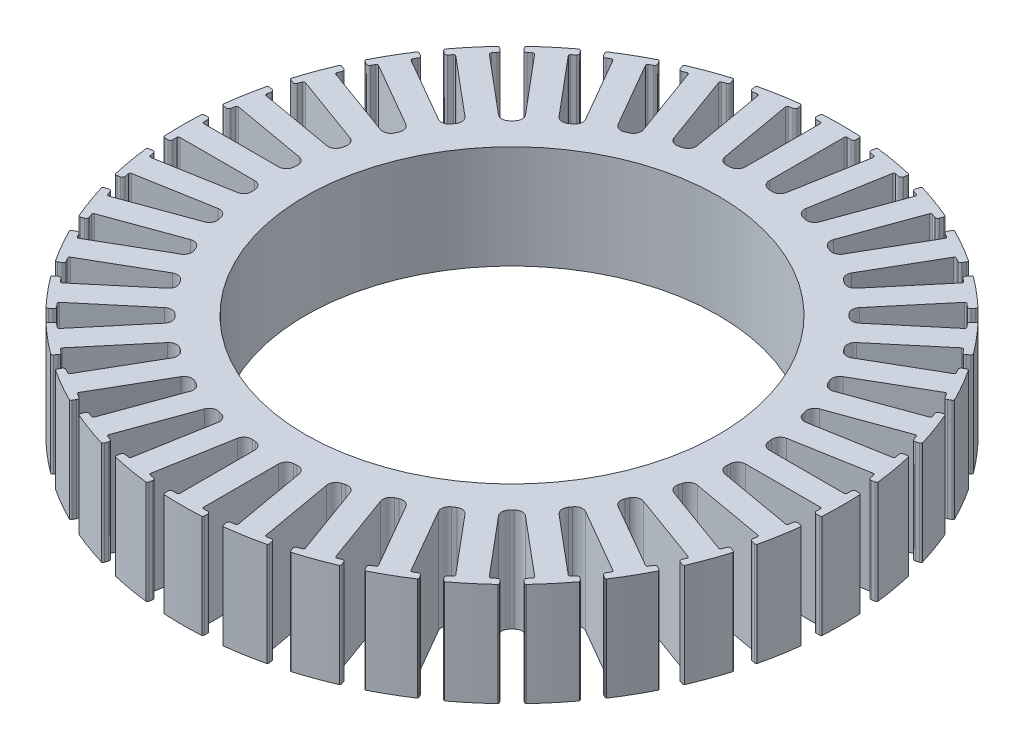
from build123d import *

# Parameters (mm, degrees)
SKETCH1_R           = 26
BOSS_EXTRUDE1_DEPTH = 13


with BuildPart() as part:
    # Sketch1 → Boss-Extrude1 (new body)
    with BuildSketch(Plane(origin=(0, 0, 0), x_dir=(1, 0, 0), z_dir=(0, 1, 0))):
        with BuildLine():
            ThreePointArc((40.3, -1.5), (40.441421356, -1.558578644), (40.5, -1.7))
            Line((40.5, -1.7), (40.5, -2.2))
            ThreePointArc((40.5, -2.2), (40.587867966, -2.412132034), (40.8, -2.5))
            Line((40.8, -2.5), (41.2, -2.5))
            ThreePointArc((41.2, -2.5), (41.327655665, -2.471484864), (41.431043872, -2.391360207))
            ThreePointArc((41.431043872, -2.391360207), (41.454359135, -1.94579256), (41.472882707, -1.5))
            ThreePointArc((41.472882707, -1.5), (41.493220123, -0.750122548), (41.5, 0))
            ThreePointArc((41.5, 0), (41.493220123, 0.750122548), (41.472882707, 1.5))
            ThreePointArc((41.472882707, 1.5), (41.454359135, 1.94579256), (41.431043872, 2.391360208))
            ThreePointArc((41.431043872, 2.391360208), (41.327655665, 2.471484864), (41.2, 2.5))
            Line((41.2, 2.5), (40.8, 2.5))
            ThreePointArc((40.8, 2.5), (40.587867966, 2.412132034), (40.5, 2.2))
            Line((40.5, 2.2), (40.5, 1.7))
            ThreePointArc((40.5, 1.7), (40.441421356, 1.558578644), (40.3, 1.5))
            Line((40.3, 1.5), (30.899029111, 1.5))
            ThreePointArc((30.899029111, 1.5), (30.221033964, 1.764933622), (29.902286236, 2.419354839))
            ThreePointArc((29.902286236, 2.419354839), (29.885840943, 2.614672282), (29.868119877, 2.809878111))
            ThreePointArc((29.868119877, 2.809878111), (30.068386059, 3.509707161), (30.690075696, 3.888348467))
            Line((30.690075696, 3.888348467), (39.948224713, 5.52080993))
            ThreePointArc((39.948224713, 5.52080993), (40.097669636, 5.487678789), (40.179915899, 5.358578015))
            Line((40.179915899, 5.358578015), (40.266739988, 4.866174139))
            ThreePointArc((40.266739988, 4.866174139), (40.390109383, 4.672522979), (40.614276767, 4.622826266))
            Line((40.614276767, 4.622826266), (41.008199868, 4.692285537))
            ThreePointArc((41.008199868, 4.692285537), (41.128964556, 4.742534638), (41.216868563, 4.839395195))
            ThreePointArc((41.216868563, 4.839395195), (41.060254143, 6.025407014), (40.86951955, 7.206411852))
            ThreePointArc((40.86951955, 7.206411852), (40.644825838, 8.381415909), (40.386357879, 9.54945534))
            ThreePointArc((40.386357879, 9.54945534), (40.27062687, 9.610409549), (40.13995898, 9.616324302))
            Line((40.13995898, 9.616324302), (39.746035879, 9.546865031))
            ThreePointArc((39.746035879, 9.546865031), (39.552384719, 9.423495636), (39.502688006, 9.199328252))
            Line((39.502688006, 9.199328252), (39.589512095, 8.706924376))
            ThreePointArc((39.589512095, 8.706924376), (39.556380953, 8.557479453), (39.42728018, 8.47523319))
            Line((39.42728018, 8.47523319), (30.169131163, 6.842771726))
            ThreePointArc((30.169131163, 6.842771726), (29.455431045, 6.985947789), (29.02788676, 7.575076915))
            ThreePointArc((29.02788676, 7.575076915), (28.977774789, 7.764571353), (28.92642581, 7.953734335))
            ThreePointArc((28.92642581, 7.953734335), (29.002125459, 8.677707267), (29.54861986, 9.158551434))
            Line((29.54861986, 9.158551434), (38.382642833, 12.373872845))
            ThreePointArc((38.382642833, 12.373872845), (38.535570514, 12.367195878), (38.638985385, 12.254338349))
            Line((38.638985385, 12.254338349), (38.809995457, 11.784492039))
            ThreePointArc((38.809995457, 11.784492039), (38.965117765, 11.615205746), (39.194509286, 11.605190296))
            Line((39.194509286, 11.605190296), (39.570386335, 11.741998353))
            ThreePointArc((39.570386335, 11.741998353), (39.68059067, 11.812454625), (39.750339559, 11.923108023))
            ThreePointArc((39.750339559, 11.923108023), (39.390155666, 13.06390587), (38.997239413, 14.193847897))
            ThreePointArc((38.997239413, 14.193847897), (38.571921997, 15.311983327), (38.114552837, 16.417395104))
            ThreePointArc((38.114552837, 16.417395104), (37.989995456, 16.457326803), (37.860285618, 16.440461457))
            Line((37.860285618, 16.440461457), (37.48440857, 16.3036534))
            ThreePointArc((37.48440857, 16.3036534), (37.315122277, 16.148531092), (37.305106827, 15.91913957))
            Line((37.305106827, 15.91913957), (37.476116898, 15.44929326))
            ThreePointArc((37.476116898, 15.44929326), (37.469439931, 15.296365579), (37.356582403, 15.192950707))
            Line((37.356582403, 15.192950707), (28.52255943, 11.977629296))
            ThreePointArc((28.52255943, 11.977629296), (27.794839758, 11.994697468), (27.271489632, 12.500634113))
            ThreePointArc((27.271489632, 12.500634113), (27.189233611, 12.678547852), (27.105816931, 12.855920367))
            ThreePointArc((27.105816931, 12.855920367), (27.054649952, 13.58203963), (27.509344162, 14.15047645))
            Line((27.509344162, 14.15047645), (35.650823773, 18.850961894))
            ThreePointArc((35.650823773, 18.850961894), (35.802587582, 18.870941979), (35.924028853, 18.777756814))
            Line((35.924028853, 18.777756814), (36.174028853, 18.344744112))
            ThreePointArc((36.174028853, 18.344744112), (36.356190761, 18.204966364), (36.583836474, 18.234936491))
            Line((36.583836474, 18.234936491), (36.930246636, 18.434936491))
            ThreePointArc((36.930246636, 18.434936491), (37.026542117, 18.523459156), (37.076016603, 18.644543247))
            ThreePointArc((37.076016603, 18.644543247), (36.523213281, 19.705453348), (35.940060611, 20.749988995))
            ThreePointArc((35.940060611, 20.749988995), (35.327036501, 21.777293038), (34.684656395, 22.786500626))
            ThreePointArc((34.684656395, 22.786500626), (34.555057253, 22.80419651), (34.430246636, 22.765063509))
            Line((34.430246636, 22.765063509), (34.083836474, 22.565063509))
            ThreePointArc((34.083836474, 22.565063509), (33.944058727, 22.382901602), (33.974028853, 22.155255888))
            Line((33.974028853, 22.155255888), (34.224028853, 21.722243186))
            ThreePointArc((34.224028853, 21.722243186), (34.244008938, 21.570479377), (34.150823773, 21.449038106))
            Line((34.150823773, 21.449038106), (26.009344162, 16.748552661))
            ThreePointArc((26.009344162, 16.748552661), (25.289716331, 16.638994334), (24.686462093, 17.046365869))
            ThreePointArc((24.686462093, 17.046365869), (24.574561329, 17.207293091), (24.461611522, 17.367485764))
            ThreePointArc((24.461611522, 17.367485764), (24.285132597, 18.073688591), (24.634210963, 18.712446399))
            Line((24.634210963, 18.712446399), (31.835772472, 24.755274006))
            ThreePointArc((31.835772472, 24.755274006), (31.981761143, 24.801304057), (32.117538883, 24.730622639))
            Line((32.117538883, 24.730622639), (32.438932688, 24.347600417))
            ThreePointArc((32.438932688, 24.347600417), (32.642599298, 24.241578291), (32.861582303, 24.310623367))
            Line((32.861582303, 24.310623367), (33.168000081, 24.567738411))
            ThreePointArc((33.168000081, 24.567738411), (33.247460817, 24.671637753), (33.275157643, 24.799473459))
            ThreePointArc((33.275157643, 24.799473459), (32.546527543, 25.748272658), (31.790852564, 26.67567606))
            ThreePointArc((31.790852564, 26.67567606), (31.00875219, 27.58092253), (30.200884219, 28.463249856))
            ThreePointArc((30.200884219, 28.463249856), (30.070181122, 28.458172245), (29.954062032, 28.397960627))
            Line((29.954062032, 28.397960627), (29.647644255, 28.140845583))
            ThreePointArc((29.647644255, 28.140845583), (29.541622128, 27.937178973), (29.610667205, 27.718195967))
            Line((29.610667205, 27.718195967), (29.93206101, 27.335173746))
            ThreePointArc((29.93206101, 27.335173746), (29.978091061, 27.189185075), (29.907409643, 27.053407335))
            Line((29.907409643, 27.053407335), (22.705848134, 21.010579729))
            ThreePointArc((22.705848134, 21.010579729), (22.01617767, 20.777723777), (21.351348894, 21.074152424))
            ThreePointArc((21.351348894, 21.074152424), (21.213203436, 21.213203436), (21.074152424, 21.351348894))
            ThreePointArc((21.074152424, 21.351348894), (20.777723777, 22.01617767), (21.010579729, 22.705848134))
            Line((21.010579729, 22.705848134), (27.053407335, 29.907409643))
            ThreePointArc((27.053407335, 29.907409643), (27.189185075, 29.978091061), (27.335173746, 29.93206101))
            Line((27.335173746, 29.93206101), (27.718195967, 29.610667205))
            ThreePointArc((27.718195967, 29.610667205), (27.937178973, 29.541622129), (28.140845583, 29.647644255))
            Line((28.140845583, 29.647644255), (28.397960627, 29.954062032))
            ThreePointArc((28.397960627, 29.954062032), (28.458172245, 30.070181122), (28.463249856, 30.200884219))
            ThreePointArc((28.463249856, 30.200884219), (27.580922542, 31.008752179), (26.675676084, 31.790852544))
            ThreePointArc((26.675676084, 31.790852544), (25.748272671, 32.546527533), (24.799473459, 33.275157643))
            ThreePointArc((24.799473459, 33.275157643), (24.671637753, 33.247460817), (24.567738411, 33.168000081))
            Line((24.567738411, 33.168000081), (24.310623367, 32.861582303))
            ThreePointArc((24.310623367, 32.861582303), (24.241578291, 32.642599298), (24.347600417, 32.438932688))
            Line((24.347600417, 32.438932688), (24.730622639, 32.117538883))
            ThreePointArc((24.730622639, 32.117538883), (24.801304057, 31.981761143), (24.755274006, 31.835772472))
            Line((24.755274006, 31.835772472), (18.712446399, 24.634210963))
            ThreePointArc((18.712446399, 24.634210963), (18.073688591, 24.285132597), (17.367485764, 24.461611522))
            ThreePointArc((17.367485764, 24.461611522), (17.207293091, 24.574561329), (17.046365869, 24.686462093))
            ThreePointArc((17.046365869, 24.686462093), (16.638994334, 25.289716331), (16.748552661, 26.009344162))
            Line((16.748552661, 26.009344162), (21.449038106, 34.150823773))
            ThreePointArc((21.449038106, 34.150823773), (21.570479377, 34.244008938), (21.722243186, 34.224028853))
            Line((21.722243186, 34.224028853), (22.155255888, 33.974028853))
            ThreePointArc((22.155255888, 33.974028853), (22.382901602, 33.944058727), (22.565063509, 34.083836474))
            Line((22.565063509, 34.083836474), (22.765063509, 34.430246636))
            ThreePointArc((22.765063509, 34.430246636), (22.804196509, 34.555057253), (22.786500625, 34.684656395))
            ThreePointArc((22.786500625, 34.684656395), (21.777293038, 35.327036501), (20.749988995, 35.940060611))
            ThreePointArc((20.749988995, 35.940060611), (19.705453348, 36.523213281), (18.644543247, 37.076016603))
            ThreePointArc((18.644543247, 37.076016603), (18.523459156, 37.026542117), (18.434936491, 36.930246636))
            Line((18.434936491, 36.930246636), (18.234936491, 36.583836474))
            ThreePointArc((18.234936491, 36.583836474), (18.204966364, 36.356190761), (18.344744112, 36.174028853))
            Line((18.344744112, 36.174028853), (18.777756814, 35.924028853))
            ThreePointArc((18.777756814, 35.924028853), (18.870941979, 35.802587582), (18.850961894, 35.650823773))
            Line((18.850961894, 35.650823773), (14.15047645, 27.509344162))
            ThreePointArc((14.15047645, 27.509344162), (13.58203963, 27.054649952), (12.855920367, 27.105816931))
            ThreePointArc((12.855920367, 27.105816931), (12.678547852, 27.189233611), (12.500634113, 27.271489632))
            ThreePointArc((12.500634113, 27.271489632), (11.994697468, 27.794839758), (11.977629296, 28.52255943))
            Line((11.977629296, 28.52255943), (15.192950707, 37.356582403))
            ThreePointArc((15.192950707, 37.356582403), (15.296365579, 37.469439931), (15.44929326, 37.476116898))
            Line((15.44929326, 37.476116898), (15.91913957, 37.305106827))
            ThreePointArc((15.91913957, 37.305106827), (16.148531092, 37.315122277), (16.3036534, 37.48440857))
            Line((16.3036534, 37.48440857), (16.440461457, 37.860285618))
            ThreePointArc((16.440461457, 37.860285618), (16.457326803, 37.989995456), (16.417395104, 38.114552837))
            ThreePointArc((16.417395104, 38.114552837), (15.311983327, 38.571921997), (14.193847897, 38.997239413))
            ThreePointArc((14.193847897, 38.997239413), (13.06390587, 39.390155666), (11.923108023, 39.750339559))
            ThreePointArc((11.923108023, 39.750339559), (11.812454625, 39.68059067), (11.741998353, 39.570386335))
            Line((11.741998353, 39.570386335), (11.605190296, 39.194509286))
            ThreePointArc((11.605190296, 39.194509286), (11.615205746, 38.965117765), (11.784492039, 38.809995457))
            Line((11.784492039, 38.809995457), (12.254338349, 38.638985385))
            ThreePointArc((12.254338349, 38.638985385), (12.367195878, 38.535570514), (12.373872845, 38.382642833))
            Line((12.373872845, 38.382642833), (9.158551434, 29.54861986))
            ThreePointArc((9.158551434, 29.54861986), (8.677707267, 29.002125459), (7.953734335, 28.92642581))
            ThreePointArc((7.953734335, 28.92642581), (7.764571353, 28.977774789), (7.575076915, 29.02788676))
            ThreePointArc((7.575076915, 29.02788676), (6.985947789, 29.455431045), (6.842771726, 30.169131163))
            Line((6.842771726, 30.169131163), (8.47523319, 39.42728018))
            ThreePointArc((8.47523319, 39.42728018), (8.557479453, 39.556380953), (8.706924376, 39.589512095))
            Line((8.706924376, 39.589512095), (9.199328252, 39.502688006))
            ThreePointArc((9.199328252, 39.502688006), (9.423495636, 39.552384719), (9.546865031, 39.746035879))
            Line((9.546865031, 39.746035879), (9.616324302, 40.13995898))
            ThreePointArc((9.616324302, 40.13995898), (9.610409549, 40.27062687), (9.54945534, 40.386357879))
            ThreePointArc((9.54945534, 40.386357879), (8.381415934, 40.644825832), (7.206411902, 40.869519541))
            ThreePointArc((7.206411902, 40.869519541), (6.025407039, 41.06025414), (4.839395195, 41.216868563))
            ThreePointArc((4.839395195, 41.216868563), (4.742534638, 41.128964556), (4.692285537, 41.008199868))
            Line((4.692285537, 41.008199868), (4.622826266, 40.614276767))
            ThreePointArc((4.622826266, 40.614276767), (4.672522979, 40.390109383), (4.866174139, 40.266739988))
            Line((4.866174139, 40.266739988), (5.358578015, 40.179915899))
            ThreePointArc((5.358578015, 40.179915899), (5.487678789, 40.097669636), (5.52080993, 39.948224713))
            Line((5.52080993, 39.948224713), (3.888348467, 30.690075696))
            ThreePointArc((3.888348467, 30.690075696), (3.509707161, 30.068386059), (2.809878111, 29.868119877))
            ThreePointArc((2.809878111, 29.868119877), (2.614672282, 29.885840943), (2.419354839, 29.902286236))
            ThreePointArc((2.419354839, 29.902286236), (1.764933622, 30.221033964), (1.5, 30.899029111))
            Line((1.5, 30.899029111), (1.5, 40.3))
            ThreePointArc((1.5, 40.3), (1.558578644, 40.441421356), (1.7, 40.5))
            Line((1.7, 40.5), (2.2, 40.5))
            ThreePointArc((2.2, 40.5), (2.412132034, 40.587867966), (2.5, 40.8))
            Line((2.5, 40.8), (2.5, 41.2))
            ThreePointArc((2.5, 41.2), (2.471484864, 41.327655665), (2.391360207, 41.431043872))
            ThreePointArc((2.391360207, 41.431043872), (1.196177099, 41.482757386), (4e-09, 41.5))
            ThreePointArc((4e-09, 41.5), (-1.196177095, 41.482757386), (-2.391360208, 41.431043872))
            ThreePointArc((-2.391360208, 41.431043872), (-2.471484864, 41.327655665), (-2.5, 41.2))
            Line((-2.5, 41.2), (-2.5, 40.8))
            ThreePointArc((-2.5, 40.8), (-2.412132034, 40.587867966), (-2.2, 40.5))
            Line((-2.2, 40.5), (-1.7, 40.5))
            ThreePointArc((-1.7, 40.5), (-1.558578644, 40.441421356), (-1.5, 40.3))
            Line((-1.5, 40.3), (-1.5, 30.899029111))
            ThreePointArc((-1.5, 30.899029111), (-1.764933622, 30.221033964), (-2.419354839, 29.902286236))
            ThreePointArc((-2.419354839, 29.902286236), (-2.614672282, 29.885840943), (-2.809878111, 29.868119877))
            ThreePointArc((-2.809878111, 29.868119877), (-3.509707161, 30.068386059), (-3.888348467, 30.690075696))
            Line((-3.888348467, 30.690075696), (-5.52080993, 39.948224713))
            ThreePointArc((-5.52080993, 39.948224713), (-5.487678789, 40.097669636), (-5.358578015, 40.179915899))
            Line((-5.358578015, 40.179915899), (-4.866174139, 40.266739988))
            ThreePointArc((-4.866174139, 40.266739988), (-4.672522979, 40.390109383), (-4.622826266, 40.614276767))
            Line((-4.622826266, 40.614276767), (-4.692285537, 41.008199868))
            ThreePointArc((-4.692285537, 41.008199868), (-4.742534638, 41.128964556), (-4.839395195, 41.216868563))
            ThreePointArc((-4.839395195, 41.216868563), (-6.025407014, 41.060254143), (-7.206411852, 40.86951955))
            ThreePointArc((-7.206411852, 40.86951955), (-8.381415909, 40.644825838), (-9.54945534, 40.386357879))
            ThreePointArc((-9.54945534, 40.386357879), (-9.610409549, 40.27062687), (-9.616324302, 40.13995898))
            Line((-9.616324302, 40.13995898), (-9.546865031, 39.746035879))
            ThreePointArc((-9.546865031, 39.746035879), (-9.423495636, 39.552384719), (-9.199328252, 39.502688006))
            Line((-9.199328252, 39.502688006), (-8.706924376, 39.589512095))
            ThreePointArc((-8.706924376, 39.589512095), (-8.557479453, 39.556380953), (-8.47523319, 39.42728018))
            Line((-8.47523319, 39.42728018), (-6.842771726, 30.169131163))
            ThreePointArc((-6.842771726, 30.169131163), (-6.985947789, 29.455431045), (-7.575076915, 29.02788676))
            Line((-7.575076915, 29.02788676), (-7.953734335, 28.929072846))
            ThreePointArc((-7.953734335, 28.929072846), (-8.677042913, 29.003735185), (-9.158551434, 29.54861986))
            Line((-9.158551434, 29.54861986), (-12.373872845, 38.382642833))
            ThreePointArc((-12.373872845, 38.382642833), (-12.367195878, 38.535570514), (-12.254338349, 38.638985385))
            Line((-12.254338349, 38.638985385), (-11.784492039, 38.809995457))
            ThreePointArc((-11.784492039, 38.809995457), (-11.615205746, 38.965117765), (-11.605190296, 39.194509286))
            Line((-11.605190296, 39.194509286), (-11.741998353, 39.570386335))
            ThreePointArc((-11.741998353, 39.570386335), (-11.812454625, 39.68059067), (-11.923108023, 39.750339559))
            ThreePointArc((-11.923108023, 39.750339559), (-13.06390587, 39.390155666), (-14.193847897, 38.997239413))
            ThreePointArc((-14.193847897, 38.997239413), (-15.311983327, 38.571921997), (-16.417395104, 38.114552837))
            ThreePointArc((-16.417395104, 38.114552837), (-16.457326803, 37.989995456), (-16.440461457, 37.860285618))
            Line((-16.440461457, 37.860285618), (-16.3036534, 37.48440857))
            ThreePointArc((-16.3036534, 37.48440857), (-16.148531092, 37.315122277), (-15.91913957, 37.305106827))
            Line((-15.91913957, 37.305106827), (-15.44929326, 37.476116898))
            ThreePointArc((-15.44929326, 37.476116898), (-15.296365579, 37.469439931), (-15.192950707, 37.356582403))
            Line((-15.192950707, 37.356582403), (-11.977629296, 28.52255943))
            ThreePointArc((-11.977629296, 28.52255943), (-11.994697468, 27.794839758), (-12.500634113, 27.271489632))
            ThreePointArc((-12.500634113, 27.271489632), (-12.678547852, 27.189233611), (-12.855920367, 27.105816931))
            ThreePointArc((-12.855920367, 27.105816931), (-13.58203963, 27.054649952), (-14.15047645, 27.509344162))
            Line((-14.15047645, 27.509344162), (-18.850961894, 35.650823773))
            ThreePointArc((-18.850961894, 35.650823773), (-18.870941979, 35.802587582), (-18.777756814, 35.924028853))
            Line((-18.777756814, 35.924028853), (-18.344744112, 36.174028853))
            ThreePointArc((-18.344744112, 36.174028853), (-18.204966364, 36.356190761), (-18.234936491, 36.583836474))
            Line((-18.234936491, 36.583836474), (-18.434936491, 36.930246636))
            ThreePointArc((-18.434936491, 36.930246636), (-18.523459156, 37.026542117), (-18.644543247, 37.076016603))
            ThreePointArc((-18.644543247, 37.076016603), (-19.705453356, 36.523213276), (-20.749989011, 35.940060601))
            ThreePointArc((-20.749989011, 35.940060601), (-21.777293046, 35.327036496), (-22.786500626, 34.684656395))
            ThreePointArc((-22.786500626, 34.684656395), (-22.80419651, 34.555057253), (-22.765063509, 34.430246636))
            Line((-22.765063509, 34.430246636), (-22.565063509, 34.083836474))
            ThreePointArc((-22.565063509, 34.083836474), (-22.382901602, 33.944058727), (-22.155255888, 33.974028853))
            Line((-22.155255888, 33.974028853), (-21.722243186, 34.224028853))
            ThreePointArc((-21.722243186, 34.224028853), (-21.570479377, 34.244008938), (-21.449038106, 34.150823773))
            Line((-21.449038106, 34.150823773), (-16.748552661, 26.009344162))
            ThreePointArc((-16.748552661, 26.009344162), (-16.638994334, 25.289716331), (-17.046365869, 24.686462093))
            ThreePointArc((-17.046365869, 24.686462093), (-17.207293091, 24.574561329), (-17.367485764, 24.461611522))
            ThreePointArc((-17.367485764, 24.461611522), (-18.073688591, 24.285132597), (-18.712446399, 24.634210963))
            Line((-18.712446399, 24.634210963), (-24.755274006, 31.835772472))
            ThreePointArc((-24.755274006, 31.835772472), (-24.801304057, 31.981761143), (-24.730622639, 32.117538883))
            Line((-24.730622639, 32.117538883), (-24.347600417, 32.438932688))
            ThreePointArc((-24.347600417, 32.438932688), (-24.241578291, 32.642599298), (-24.310623367, 32.861582303))
            Line((-24.310623367, 32.861582303), (-24.567738411, 33.168000081))
            ThreePointArc((-24.567738411, 33.168000081), (-24.671637753, 33.247460817), (-24.799473459, 33.275157643))
            ThreePointArc((-24.799473459, 33.275157643), (-25.748272658, 32.546527543), (-26.67567606, 31.790852564))
            ThreePointArc((-26.67567606, 31.790852564), (-27.58092253, 31.00875219), (-28.463249856, 30.200884219))
            ThreePointArc((-28.463249856, 30.200884219), (-28.458172245, 30.070181122), (-28.397960627, 29.954062032))
            Line((-28.397960627, 29.954062032), (-28.140845583, 29.647644255))
            ThreePointArc((-28.140845583, 29.647644255), (-27.937178973, 29.541622128), (-27.718195967, 29.610667205))
            Line((-27.718195967, 29.610667205), (-27.335173746, 29.93206101))
            ThreePointArc((-27.335173746, 29.93206101), (-27.189185075, 29.978091061), (-27.053407335, 29.907409643))
            Line((-27.053407335, 29.907409643), (-21.010579729, 22.705848134))
            ThreePointArc((-21.010579729, 22.705848134), (-20.777723777, 22.01617767), (-21.074152424, 21.351348894))
            ThreePointArc((-21.074152424, 21.351348894), (-21.213203436, 21.213203436), (-21.351348894, 21.074152424))
            ThreePointArc((-21.351348894, 21.074152424), (-22.01617767, 20.777723777), (-22.705848134, 21.010579729))
            Line((-22.705848134, 21.010579729), (-29.907409643, 27.053407335))
            ThreePointArc((-29.907409643, 27.053407335), (-29.978091061, 27.189185075), (-29.93206101, 27.335173746))
            Line((-29.93206101, 27.335173746), (-29.610667205, 27.718195967))
            ThreePointArc((-29.610667205, 27.718195967), (-29.541622129, 27.937178973), (-29.647644255, 28.140845583))
            Line((-29.647644255, 28.140845583), (-29.954062032, 28.397960627))
            ThreePointArc((-29.954062032, 28.397960627), (-30.070181122, 28.458172245), (-30.200884219, 28.463249856))
            ThreePointArc((-30.200884219, 28.463249856), (-31.008752176, 27.580922546), (-31.790852537, 26.675676092))
            ThreePointArc((-31.790852537, 26.675676092), (-32.54652753, 25.748272675), (-33.275157643, 24.799473459))
            ThreePointArc((-33.275157643, 24.799473459), (-33.247460817, 24.671637753), (-33.168000081, 24.567738411))
            Line((-33.168000081, 24.567738411), (-32.861582303, 24.310623367))
            ThreePointArc((-32.861582303, 24.310623367), (-32.642599298, 24.241578291), (-32.438932688, 24.347600417))
            Line((-32.438932688, 24.347600417), (-32.117538883, 24.730622639))
            ThreePointArc((-32.117538883, 24.730622639), (-31.981761143, 24.801304057), (-31.835772472, 24.755274006))
            Line((-31.835772472, 24.755274006), (-24.634210963, 18.712446399))
            ThreePointArc((-24.634210963, 18.712446399), (-24.285132597, 18.073688591), (-24.461611522, 17.367485764))
            ThreePointArc((-24.461611522, 17.367485764), (-24.574561329, 17.207293091), (-24.686462093, 17.046365869))
            ThreePointArc((-24.686462093, 17.046365869), (-25.289716331, 16.638994334), (-26.009344162, 16.748552661))
            Line((-26.009344162, 16.748552661), (-34.150823773, 21.449038106))
            ThreePointArc((-34.150823773, 21.449038106), (-34.244008938, 21.570479377), (-34.224028853, 21.722243186))
            Line((-34.224028853, 21.722243186), (-33.974028853, 22.155255888))
            ThreePointArc((-33.974028853, 22.155255888), (-33.944058727, 22.382901602), (-34.083836474, 22.565063509))
            Line((-34.083836474, 22.565063509), (-34.430246636, 22.765063509))
            ThreePointArc((-34.430246636, 22.765063509), (-34.555057253, 22.804196509), (-34.684656395, 22.786500625))
            ThreePointArc((-34.684656395, 22.786500625), (-35.327036496, 21.777293046), (-35.940060601, 20.749989011))
            ThreePointArc((-35.940060601, 20.749989011), (-36.523213276, 19.705453356), (-37.076016603, 18.644543247))
            ThreePointArc((-37.076016603, 18.644543247), (-37.026542117, 18.523459156), (-36.930246636, 18.434936491))
            Line((-36.930246636, 18.434936491), (-36.583836474, 18.234936491))
            ThreePointArc((-36.583836474, 18.234936491), (-36.356190761, 18.204966364), (-36.174028853, 18.344744112))
            Line((-36.174028853, 18.344744112), (-35.924028853, 18.777756814))
            ThreePointArc((-35.924028853, 18.777756814), (-35.802587582, 18.870941979), (-35.650823773, 18.850961894))
            Line((-35.650823773, 18.850961894), (-27.509344162, 14.15047645))
            ThreePointArc((-27.509344162, 14.15047645), (-27.054649952, 13.58203963), (-27.105816931, 12.855920367))
            ThreePointArc((-27.105816931, 12.855920367), (-27.189233611, 12.678547852), (-27.271489632, 12.500634113))
            ThreePointArc((-27.271489632, 12.500634113), (-27.794839758, 11.994697468), (-28.52255943, 11.977629296))
            Line((-28.52255943, 11.977629296), (-37.356582403, 15.192950707))
            ThreePointArc((-37.356582403, 15.192950707), (-37.469439931, 15.296365579), (-37.476116898, 15.44929326))
            Line((-37.476116898, 15.44929326), (-37.305106827, 15.91913957))
            ThreePointArc((-37.305106827, 15.91913957), (-37.315122277, 16.148531092), (-37.48440857, 16.3036534))
            Line((-37.48440857, 16.3036534), (-37.860285618, 16.440461457))
            ThreePointArc((-37.860285618, 16.440461457), (-37.989995456, 16.457326803), (-38.114552837, 16.417395104))
            ThreePointArc((-38.114552837, 16.417395104), (-38.571921997, 15.311983327), (-38.997239413, 14.193847897))
            ThreePointArc((-38.997239413, 14.193847897), (-39.390155666, 13.06390587), (-39.750339559, 11.923108023))
            ThreePointArc((-39.750339559, 11.923108023), (-39.68059067, 11.812454625), (-39.570386335, 11.741998353))
            Line((-39.570386335, 11.741998353), (-39.194509286, 11.605190296))
            ThreePointArc((-39.194509286, 11.605190296), (-38.965117765, 11.615205746), (-38.809995457, 11.784492039))
            Line((-38.809995457, 11.784492039), (-38.638985385, 12.254338349))
            ThreePointArc((-38.638985385, 12.254338349), (-38.535570514, 12.367195878), (-38.382642833, 12.373872845))
            Line((-38.382642833, 12.373872845), (-29.54861986, 9.158551434))
            ThreePointArc((-29.54861986, 9.158551434), (-29.002125459, 8.677707267), (-28.92642581, 7.953734335))
            ThreePointArc((-28.92642581, 7.953734335), (-28.977774789, 7.764571353), (-29.02788676, 7.575076915))
            ThreePointArc((-29.02788676, 7.575076915), (-29.455431045, 6.985947789), (-30.169131163, 6.842771726))
            Line((-30.169131163, 6.842771726), (-39.42728018, 8.47523319))
            ThreePointArc((-39.42728018, 8.47523319), (-39.556380953, 8.557479453), (-39.589512095, 8.706924376))
            Line((-39.589512095, 8.706924376), (-39.502688006, 9.199328252))
            ThreePointArc((-39.502688006, 9.199328252), (-39.552384719, 9.423495636), (-39.746035879, 9.546865031))
            Line((-39.746035879, 9.546865031), (-40.13995898, 9.616324302))
            ThreePointArc((-40.13995898, 9.616324302), (-40.27062687, 9.610409549), (-40.386357879, 9.54945534))
            ThreePointArc((-40.386357879, 9.54945534), (-40.644825833, 8.381415929), (-40.869519543, 7.206411893))
            ThreePointArc((-40.869519543, 7.206411893), (-41.06025414, 6.025407034), (-41.216868563, 4.839395195))
            ThreePointArc((-41.216868563, 4.839395195), (-41.128964556, 4.742534638), (-41.008199868, 4.692285537))
            Line((-41.008199868, 4.692285537), (-40.614276767, 4.622826266))
            ThreePointArc((-40.614276767, 4.622826266), (-40.390109383, 4.672522979), (-40.266739988, 4.866174139))
            Line((-40.266739988, 4.866174139), (-40.179915899, 5.358578015))
            ThreePointArc((-40.179915899, 5.358578015), (-40.097669636, 5.487678789), (-39.948224713, 5.52080993))
            Line((-39.948224713, 5.52080993), (-30.690075696, 3.888348467))
            ThreePointArc((-30.690075696, 3.888348467), (-30.068386059, 3.509707161), (-29.868119877, 2.809878111))
            ThreePointArc((-29.868119877, 2.809878111), (-29.885840943, 2.614672282), (-29.902286236, 2.419354839))
            ThreePointArc((-29.902286236, 2.419354839), (-30.221033964, 1.764933622), (-30.899029111, 1.5))
            Line((-30.899029111, 1.5), (-40.3, 1.5))
            ThreePointArc((-40.3, 1.5), (-40.441421356, 1.558578644), (-40.5, 1.7))
            Line((-40.5, 1.7), (-40.5, 2.2))
            ThreePointArc((-40.5, 2.2), (-40.587867966, 2.412132034), (-40.8, 2.5))
            Line((-40.8, 2.5), (-41.2, 2.5))
            ThreePointArc((-41.2, 2.5), (-41.327655665, 2.471484864), (-41.431043872, 2.391360207))
            ThreePointArc((-41.431043872, 2.391360207), (-41.482757386, 1.196177103), (-41.5, 1.3e-08))
            ThreePointArc((-41.5, 1.3e-08), (-41.482757386, -1.196177091), (-41.431043872, -2.391360208))
            ThreePointArc((-41.431043872, -2.391360208), (-41.327655665, -2.471484864), (-41.2, -2.5))
            Line((-41.2, -2.5), (-40.8, -2.5))
            ThreePointArc((-40.8, -2.5), (-40.587867966, -2.412132034), (-40.5, -2.2))
            Line((-40.5, -2.2), (-40.5, -1.7))
            ThreePointArc((-40.5, -1.7), (-40.441421356, -1.558578644), (-40.3, -1.5))
            Line((-40.3, -1.5), (-30.899029111, -1.5))
            ThreePointArc((-30.899029111, -1.5), (-30.221033964, -1.764933622), (-29.902286236, -2.419354839))
            ThreePointArc((-29.902286236, -2.419354839), (-29.885840943, -2.614672282), (-29.868119877, -2.809878111))
            ThreePointArc((-29.868119877, -2.809878111), (-30.068386059, -3.509707161), (-30.690075696, -3.888348467))
            Line((-30.690075696, -3.888348467), (-39.948224713, -5.52080993))
            ThreePointArc((-39.948224713, -5.52080993), (-40.097669636, -5.487678789), (-40.179915899, -5.358578015))
            Line((-40.179915899, -5.358578015), (-40.266739988, -4.866174139))
            ThreePointArc((-40.266739988, -4.866174139), (-40.390109383, -4.672522979), (-40.614276767, -4.622826266))
            Line((-40.614276767, -4.622826266), (-41.008199868, -4.692285537))
            ThreePointArc((-41.008199868, -4.692285537), (-41.128964556, -4.742534638), (-41.216868563, -4.839395195))
            ThreePointArc((-41.216868563, -4.839395195), (-41.06025414, -6.025407039), (-40.869519541, -7.206411902))
            ThreePointArc((-40.869519541, -7.206411902), (-40.644825832, -8.381415934), (-40.386357879, -9.54945534))
            ThreePointArc((-40.386357879, -9.54945534), (-40.27062687, -9.610409549), (-40.13995898, -9.616324302))
            Line((-40.13995898, -9.616324302), (-39.746035879, -9.546865031))
            ThreePointArc((-39.746035879, -9.546865031), (-39.552384719, -9.423495636), (-39.502688006, -9.199328252))
            Line((-39.502688006, -9.199328252), (-39.589512095, -8.706924376))
            ThreePointArc((-39.589512095, -8.706924376), (-39.556380953, -8.557479453), (-39.42728018, -8.47523319))
            Line((-39.42728018, -8.47523319), (-30.169131163, -6.842771726))
            ThreePointArc((-30.169131163, -6.842771726), (-29.455431045, -6.985947789), (-29.02788676, -7.575076915))
            ThreePointArc((-29.02788676, -7.575076915), (-28.977774789, -7.764571353), (-28.92642581, -7.953734335))
            ThreePointArc((-28.92642581, -7.953734335), (-29.002125459, -8.677707267), (-29.54861986, -9.158551434))
            Line((-29.54861986, -9.158551434), (-38.382642833, -12.373872845))
            ThreePointArc((-38.382642833, -12.373872845), (-38.535570514, -12.367195878), (-38.638985385, -12.254338349))
            Line((-38.638985385, -12.254338349), (-38.809995457, -11.784492039))
            ThreePointArc((-38.809995457, -11.784492039), (-38.965117765, -11.615205746), (-39.194509286, -11.605190296))
            Line((-39.194509286, -11.605190296), (-39.570386335, -11.741998353))
            ThreePointArc((-39.570386335, -11.741998353), (-39.68059067, -11.812454625), (-39.750339559, -11.923108023))
            ThreePointArc((-39.750339559, -11.923108023), (-39.39015567, -13.063905858), (-38.997239422, -14.193847873))
            ThreePointArc((-38.997239422, -14.193847873), (-38.571922002, -15.311983316), (-38.114552837, -16.417395104))
            ThreePointArc((-38.114552837, -16.417395104), (-37.989995456, -16.457326803), (-37.860285618, -16.440461457))
            Line((-37.860285618, -16.440461457), (-37.48440857, -16.3036534))
            ThreePointArc((-37.48440857, -16.3036534), (-37.315122277, -16.148531092), (-37.305106827, -15.91913957))
            Line((-37.305106827, -15.91913957), (-37.476116898, -15.44929326))
            ThreePointArc((-37.476116898, -15.44929326), (-37.469439931, -15.296365579), (-37.356582403, -15.192950707))
            Line((-37.356582403, -15.192950707), (-28.52255943, -11.977629296))
            ThreePointArc((-28.52255943, -11.977629296), (-27.794839758, -11.994697468), (-27.271489632, -12.500634113))
            ThreePointArc((-27.271489632, -12.500634113), (-27.189233611, -12.678547852), (-27.105816931, -12.855920367))
            ThreePointArc((-27.105816931, -12.855920367), (-27.054649952, -13.58203963), (-27.509344162, -14.15047645))
            Line((-27.509344162, -14.15047645), (-35.650823773, -18.850961894))
            ThreePointArc((-35.650823773, -18.850961894), (-35.802587582, -18.870941979), (-35.924028853, -18.777756814))
            Line((-35.924028853, -18.777756814), (-36.174028853, -18.344744112))
            ThreePointArc((-36.174028853, -18.344744112), (-36.356190761, -18.204966364), (-36.583836474, -18.234936491))
            Line((-36.583836474, -18.234936491), (-36.930246636, -18.434936491))
            ThreePointArc((-36.930246636, -18.434936491), (-37.026542117, -18.523459156), (-37.076016603, -18.644543247))
            ThreePointArc((-37.076016603, -18.644543247), (-36.523213276, -19.705453356), (-35.940060601, -20.749989011))
            ThreePointArc((-35.940060601, -20.749989011), (-35.327036496, -21.777293046), (-34.684656395, -22.786500626))
            ThreePointArc((-34.684656395, -22.786500626), (-34.555057253, -22.80419651), (-34.430246636, -22.765063509))
            Line((-34.430246636, -22.765063509), (-34.083836474, -22.565063509))
            ThreePointArc((-34.083836474, -22.565063509), (-33.944058727, -22.382901602), (-33.974028853, -22.155255888))
            Line((-33.974028853, -22.155255888), (-34.224028853, -21.722243186))
            ThreePointArc((-34.224028853, -21.722243186), (-34.244008938, -21.570479377), (-34.150823773, -21.449038106))
            Line((-34.150823773, -21.449038106), (-26.009344162, -16.748552661))
            ThreePointArc((-26.009344162, -16.748552661), (-25.289716331, -16.638994334), (-24.686462093, -17.046365869))
            ThreePointArc((-24.686462093, -17.046365869), (-24.574561329, -17.207293091), (-24.461611522, -17.367485764))
            ThreePointArc((-24.461611522, -17.367485764), (-24.285132597, -18.073688591), (-24.634210963, -18.712446399))
            Line((-24.634210963, -18.712446399), (-31.835772472, -24.755274006))
            ThreePointArc((-31.835772472, -24.755274006), (-31.981761143, -24.801304057), (-32.117538883, -24.730622639))
            Line((-32.117538883, -24.730622639), (-32.438932688, -24.347600417))
            ThreePointArc((-32.438932688, -24.347600417), (-32.642599298, -24.241578291), (-32.861582303, -24.310623367))
            Line((-32.861582303, -24.310623367), (-33.168000081, -24.567738411))
            ThreePointArc((-33.168000081, -24.567738411), (-33.247460817, -24.671637753), (-33.275157643, -24.799473459))
            ThreePointArc((-33.275157643, -24.799473459), (-32.546527543, -25.748272658), (-31.790852564, -26.67567606))
            ThreePointArc((-31.790852564, -26.67567606), (-31.00875219, -27.58092253), (-30.200884219, -28.463249856))
            ThreePointArc((-30.200884219, -28.463249856), (-30.070181122, -28.458172245), (-29.954062032, -28.397960627))
            Line((-29.954062032, -28.397960627), (-29.647644255, -28.140845583))
            ThreePointArc((-29.647644255, -28.140845583), (-29.541622128, -27.937178973), (-29.610667205, -27.718195967))
            Line((-29.610667205, -27.718195967), (-29.93206101, -27.335173746))
            ThreePointArc((-29.93206101, -27.335173746), (-29.978091061, -27.189185075), (-29.907409643, -27.053407335))
            Line((-29.907409643, -27.053407335), (-22.705848134, -21.010579729))
            ThreePointArc((-22.705848134, -21.010579729), (-22.01617767, -20.777723777), (-21.351348894, -21.074152424))
            ThreePointArc((-21.351348894, -21.074152424), (-21.213203436, -21.213203436), (-21.074152424, -21.351348894))
            ThreePointArc((-21.074152424, -21.351348894), (-20.777723777, -22.01617767), (-21.010579729, -22.705848134))
            Line((-21.010579729, -22.705848134), (-27.053407335, -29.907409643))
            ThreePointArc((-27.053407335, -29.907409643), (-27.189185075, -29.978091061), (-27.335173746, -29.93206101))
            Line((-27.335173746, -29.93206101), (-27.718195967, -29.610667205))
            ThreePointArc((-27.718195967, -29.610667205), (-27.937178973, -29.541622129), (-28.140845583, -29.647644255))
            Line((-28.140845583, -29.647644255), (-28.397960627, -29.954062032))
            ThreePointArc((-28.397960627, -29.954062032), (-28.458172245, -30.070181122), (-28.463249856, -30.200884219))
            ThreePointArc((-28.463249856, -30.200884219), (-27.58092254, -31.008752181), (-26.675676079, -31.790852548))
            ThreePointArc((-26.675676079, -31.790852548), (-25.748272668, -32.546527535), (-24.799473459, -33.275157643))
            ThreePointArc((-24.799473459, -33.275157643), (-24.671637753, -33.247460817), (-24.567738411, -33.168000081))
            Line((-24.567738411, -33.168000081), (-24.310623367, -32.861582303))
            ThreePointArc((-24.310623367, -32.861582303), (-24.241578291, -32.642599298), (-24.347600417, -32.438932688))
            Line((-24.347600417, -32.438932688), (-24.730622639, -32.117538883))
            ThreePointArc((-24.730622639, -32.117538883), (-24.801304057, -31.981761143), (-24.755274006, -31.835772472))
            Line((-24.755274006, -31.835772472), (-18.712446399, -24.634210963))
            ThreePointArc((-18.712446399, -24.634210963), (-18.073688591, -24.285132597), (-17.367485764, -24.461611522))
            ThreePointArc((-17.367485764, -24.461611522), (-17.207293091, -24.574561329), (-17.046365869, -24.686462093))
            ThreePointArc((-17.046365869, -24.686462093), (-16.638994334, -25.289716331), (-16.748552661, -26.009344162))
            Line((-16.748552661, -26.009344162), (-21.449038106, -34.150823773))
            ThreePointArc((-21.449038106, -34.150823773), (-21.570479377, -34.244008938), (-21.722243186, -34.224028853))
            Line((-21.722243186, -34.224028853), (-22.155255888, -33.974028853))
            ThreePointArc((-22.155255888, -33.974028853), (-22.382901602, -33.944058727), (-22.565063509, -34.083836474))
            Line((-22.565063509, -34.083836474), (-22.765063509, -34.430246636))
            ThreePointArc((-22.765063509, -34.430246636), (-22.804196509, -34.555057253), (-22.786500625, -34.684656395))
            ThreePointArc((-22.786500625, -34.684656395), (-21.777293051, -35.327036493), (-20.749989021, -35.940060596))
            ThreePointArc((-20.749989021, -35.940060596), (-19.705453361, -36.523213274), (-18.644543247, -37.076016603))
            ThreePointArc((-18.644543247, -37.076016603), (-18.523459156, -37.026542117), (-18.434936491, -36.930246636))
            Line((-18.434936491, -36.930246636), (-18.234936491, -36.583836474))
            ThreePointArc((-18.234936491, -36.583836474), (-18.204966364, -36.356190761), (-18.344744112, -36.174028853))
            Line((-18.344744112, -36.174028853), (-18.777756814, -35.924028853))
            ThreePointArc((-18.777756814, -35.924028853), (-18.870941979, -35.802587582), (-18.850961894, -35.650823773))
            Line((-18.850961894, -35.650823773), (-14.15047645, -27.509344162))
            ThreePointArc((-14.15047645, -27.509344162), (-13.58203963, -27.054649952), (-12.855920367, -27.105816931))
            ThreePointArc((-12.855920367, -27.105816931), (-12.678547852, -27.189233611), (-12.500634113, -27.271489632))
            ThreePointArc((-12.500634113, -27.271489632), (-11.994697468, -27.794839758), (-11.977629296, -28.52255943))
            Line((-11.977629296, -28.52255943), (-15.192950707, -37.356582403))
            ThreePointArc((-15.192950707, -37.356582403), (-15.296365579, -37.469439931), (-15.44929326, -37.476116898))
            Line((-15.44929326, -37.476116898), (-15.91913957, -37.305106827))
            ThreePointArc((-15.91913957, -37.305106827), (-16.148531092, -37.315122277), (-16.3036534, -37.48440857))
            Line((-16.3036534, -37.48440857), (-16.440461457, -37.860285618))
            ThreePointArc((-16.440461457, -37.860285618), (-16.457326803, -37.989995456), (-16.417395104, -38.114552837))
            ThreePointArc((-16.417395104, -38.114552837), (-15.311983327, -38.571921998), (-14.193847897, -38.997239413))
            ThreePointArc((-14.193847897, -38.997239413), (-13.06390587, -39.390155666), (-11.923108023, -39.750339559))
            ThreePointArc((-11.923108023, -39.750339559), (-11.812454625, -39.68059067), (-11.741998353, -39.570386335))
            Line((-11.741998353, -39.570386335), (-11.605190296, -39.194509286))
            ThreePointArc((-11.605190296, -39.194509286), (-11.615205746, -38.965117765), (-11.784492039, -38.809995457))
            Line((-11.784492039, -38.809995457), (-12.254338349, -38.638985385))
            ThreePointArc((-12.254338349, -38.638985385), (-12.367195878, -38.535570514), (-12.373872845, -38.382642833))
            Line((-12.373872845, -38.382642833), (-9.158551434, -29.54861986))
            ThreePointArc((-9.158551434, -29.54861986), (-8.677707267, -29.002125459), (-7.953734335, -28.92642581))
            ThreePointArc((-7.953734335, -28.92642581), (-7.764571353, -28.977774789), (-7.575076915, -29.02788676))
            ThreePointArc((-7.575076915, -29.02788676), (-6.985947789, -29.455431045), (-6.842771726, -30.169131163))
            Line((-6.842771726, -30.169131163), (-8.47523319, -39.42728018))
            ThreePointArc((-8.47523319, -39.42728018), (-8.557479453, -39.556380953), (-8.706924376, -39.589512095))
            Line((-8.706924376, -39.589512095), (-9.199328252, -39.502688006))
            ThreePointArc((-9.199328252, -39.502688006), (-9.423495636, -39.552384719), (-9.546865031, -39.746035879))
            Line((-9.546865031, -39.746035879), (-9.616324302, -40.13995898))
            ThreePointArc((-9.616324302, -40.13995898), (-9.610409549, -40.27062687), (-9.54945534, -40.386357879))
            ThreePointArc((-9.54945534, -40.386357879), (-8.381415929, -40.644825833), (-7.206411893, -40.869519543))
            ThreePointArc((-7.206411893, -40.869519543), (-6.025407034, -41.06025414), (-4.839395195, -41.216868563))
            ThreePointArc((-4.839395195, -41.216868563), (-4.742534638, -41.128964556), (-4.692285537, -41.008199868))
            Line((-4.692285537, -41.008199868), (-4.622826266, -40.614276767))
            ThreePointArc((-4.622826266, -40.614276767), (-4.672522979, -40.390109383), (-4.866174139, -40.266739988))
            Line((-4.866174139, -40.266739988), (-5.358578015, -40.179915899))
            ThreePointArc((-5.358578015, -40.179915899), (-5.487678789, -40.097669636), (-5.52080993, -39.948224713))
            Line((-5.52080993, -39.948224713), (-3.888348467, -30.690075696))
            ThreePointArc((-3.888348467, -30.690075696), (-3.509707161, -30.068386059), (-2.809878111, -29.868119877))
            ThreePointArc((-2.809878111, -29.868119877), (-2.614672282, -29.885840943), (-2.419354839, -29.902286236))
            ThreePointArc((-2.419354839, -29.902286236), (-1.764933622, -30.221033964), (-1.5, -30.899029111))
            Line((-1.5, -30.899029111), (-1.5, -40.3))
            ThreePointArc((-1.5, -40.3), (-1.558578644, -40.441421356), (-1.7, -40.5))
            Line((-1.7, -40.5), (-2.2, -40.5))
            ThreePointArc((-2.2, -40.5), (-2.412132034, -40.587867966), (-2.5, -40.8))
            Line((-2.5, -40.8), (-2.5, -41.2))
            ThreePointArc((-2.5, -41.2), (-2.471484864, -41.327655665), (-2.391360207, -41.431043872))
            ThreePointArc((-2.391360207, -41.431043872), (-1.196177103, -41.482757386), (-1.3e-08, -41.5))
            ThreePointArc((-1.3e-08, -41.5), (1.196177091, -41.482757386), (2.391360208, -41.431043872))
            ThreePointArc((2.391360208, -41.431043872), (2.471484864, -41.327655665), (2.5, -41.2))
            Line((2.5, -41.2), (2.5, -40.8))
            ThreePointArc((2.5, -40.8), (2.412132034, -40.587867966), (2.2, -40.5))
            Line((2.2, -40.5), (1.7, -40.5))
            ThreePointArc((1.7, -40.5), (1.558578644, -40.441421356), (1.5, -40.3))
            Line((1.5, -40.3), (1.5, -30.899029111))
            ThreePointArc((1.5, -30.899029111), (1.764933622, -30.221033964), (2.419354839, -29.902286236))
            ThreePointArc((2.419354839, -29.902286236), (2.614672282, -29.885840943), (2.809878111, -29.868119877))
            ThreePointArc((2.809878111, -29.868119877), (3.509707161, -30.068386059), (3.888348467, -30.690075696))
            Line((3.888348467, -30.690075696), (5.52080993, -39.948224713))
            ThreePointArc((5.52080993, -39.948224713), (5.487678789, -40.097669636), (5.358578015, -40.179915899))
            Line((5.358578015, -40.179915899), (4.866174139, -40.266739988))
            ThreePointArc((4.866174139, -40.266739988), (4.672522979, -40.390109383), (4.622826266, -40.614276767))
            Line((4.622826266, -40.614276767), (4.692285537, -41.008199868))
            ThreePointArc((4.692285537, -41.008199868), (4.742534638, -41.128964556), (4.839395195, -41.216868563))
            ThreePointArc((4.839395195, -41.216868563), (6.025407034, -41.06025414), (7.206411893, -40.869519543))
            ThreePointArc((7.206411893, -40.869519543), (8.381415929, -40.644825833), (9.54945534, -40.386357879))
            ThreePointArc((9.54945534, -40.386357879), (9.610409549, -40.27062687), (9.616324302, -40.13995898))
            Line((9.616324302, -40.13995898), (9.546865031, -39.746035879))
            ThreePointArc((9.546865031, -39.746035879), (9.423495636, -39.552384719), (9.199328252, -39.502688006))
            Line((9.199328252, -39.502688006), (8.706924376, -39.589512095))
            ThreePointArc((8.706924376, -39.589512095), (8.557479453, -39.556380953), (8.47523319, -39.42728018))
            Line((8.47523319, -39.42728018), (6.842771726, -30.169131163))
            ThreePointArc((6.842771726, -30.169131163), (6.985947789, -29.455431045), (7.575076915, -29.02788676))
            ThreePointArc((7.575076915, -29.02788676), (7.764571353, -28.977774789), (7.953734335, -28.92642581))
            ThreePointArc((7.953734335, -28.92642581), (8.677707267, -29.002125459), (9.158551434, -29.54861986))
            Line((9.158551434, -29.54861986), (12.373872845, -38.382642833))
            ThreePointArc((12.373872845, -38.382642833), (12.367195878, -38.535570514), (12.254338349, -38.638985385))
            Line((12.254338349, -38.638985385), (11.784492039, -38.809995457))
            ThreePointArc((11.784492039, -38.809995457), (11.615205746, -38.965117765), (11.605190296, -39.194509286))
            Line((11.605190296, -39.194509286), (11.741998353, -39.570386335))
            ThreePointArc((11.741998353, -39.570386335), (11.812454625, -39.68059067), (11.923108023, -39.750339559))
            ThreePointArc((11.923108023, -39.750339559), (13.06390587, -39.390155666), (14.193847897, -38.997239413))
            ThreePointArc((14.193847897, -38.997239413), (15.311983327, -38.571921997), (16.417395104, -38.114552837))
            ThreePointArc((16.417395104, -38.114552837), (16.457326803, -37.989995456), (16.440461457, -37.860285618))
            Line((16.440461457, -37.860285618), (16.3036534, -37.48440857))
            ThreePointArc((16.3036534, -37.48440857), (16.148531092, -37.315122277), (15.91913957, -37.305106827))
            Line((15.91913957, -37.305106827), (15.44929326, -37.476116898))
            ThreePointArc((15.44929326, -37.476116898), (15.296365579, -37.469439931), (15.192950707, -37.356582403))
            Line((15.192950707, -37.356582403), (11.977629296, -28.52255943))
            ThreePointArc((11.977629296, -28.52255943), (11.994697468, -27.794839758), (12.500634113, -27.271489632))
            ThreePointArc((12.500634113, -27.271489632), (12.678547852, -27.189233611), (12.855920367, -27.105816931))
            ThreePointArc((12.855920367, -27.105816931), (13.58203963, -27.054649952), (14.15047645, -27.509344162))
            Line((14.15047645, -27.509344162), (18.850961894, -35.650823773))
            ThreePointArc((18.850961894, -35.650823773), (18.870941979, -35.802587582), (18.777756814, -35.924028853))
            Line((18.777756814, -35.924028853), (18.344744112, -36.174028853))
            ThreePointArc((18.344744112, -36.174028853), (18.204966364, -36.356190761), (18.234936491, -36.583836474))
            Line((18.234936491, -36.583836474), (18.434936491, -36.930246636))
            ThreePointArc((18.434936491, -36.930246636), (18.523459156, -37.026542117), (18.644543247, -37.076016603))
            ThreePointArc((18.644543247, -37.076016603), (19.705453356, -36.523213276), (20.749989011, -35.940060601))
            ThreePointArc((20.749989011, -35.940060601), (21.777293046, -35.327036496), (22.786500626, -34.684656395))
            ThreePointArc((22.786500626, -34.684656395), (22.80419651, -34.555057253), (22.765063509, -34.430246636))
            Line((22.765063509, -34.430246636), (22.565063509, -34.083836474))
            ThreePointArc((22.565063509, -34.083836474), (22.382901602, -33.944058727), (22.155255888, -33.974028853))
            Line((22.155255888, -33.974028853), (21.722243186, -34.224028853))
            ThreePointArc((21.722243186, -34.224028853), (21.570479377, -34.244008938), (21.449038106, -34.150823773))
            Line((21.449038106, -34.150823773), (16.748552661, -26.009344162))
            ThreePointArc((16.748552661, -26.009344162), (16.638994334, -25.289716331), (17.046365869, -24.686462093))
            Line((17.046365869, -24.686462093), (17.439522695, -24.414981511))
            Line((17.439522695, -24.414981511), (17.484062412, -24.38422618))
            ThreePointArc((17.484062412, -24.38422618), (18.142287183, -24.292848767), (18.712446399, -24.634210963))
            Line((18.712446399, -24.634210963), (24.755274006, -31.835772472))
            ThreePointArc((24.755274006, -31.835772472), (24.801304057, -31.981761143), (24.730622639, -32.117538883))
            Line((24.730622639, -32.117538883), (24.347600417, -32.438932688))
            ThreePointArc((24.347600417, -32.438932688), (24.241578291, -32.642599298), (24.310623367, -32.861582303))
            Line((24.310623367, -32.861582303), (24.567738411, -33.168000081))
            ThreePointArc((24.567738411, -33.168000081), (24.671637753, -33.247460817), (24.799473459, -33.275157643))
            ThreePointArc((24.799473459, -33.275157643), (25.748272658, -32.546527543), (26.67567606, -31.790852564))
            ThreePointArc((26.67567606, -31.790852564), (27.58092253, -31.00875219), (28.463249856, -30.200884219))
            ThreePointArc((28.463249856, -30.200884219), (28.458172245, -30.070181122), (28.397960627, -29.954062032))
            Line((28.397960627, -29.954062032), (28.140845583, -29.647644255))
            ThreePointArc((28.140845583, -29.647644255), (27.937178973, -29.541622128), (27.718195967, -29.610667205))
            Line((27.718195967, -29.610667205), (27.335173746, -29.93206101))
            ThreePointArc((27.335173746, -29.93206101), (27.189185075, -29.978091061), (27.053407335, -29.907409643))
            Line((27.053407335, -29.907409643), (21.010579729, -22.705848134))
            ThreePointArc((21.010579729, -22.705848134), (20.777723777, -22.01617767), (21.074152424, -21.351348894))
            ThreePointArc((21.074152424, -21.351348894), (21.213203436, -21.213203436), (21.351348894, -21.074152424))
            ThreePointArc((21.351348894, -21.074152424), (22.01617767, -20.777723777), (22.705848134, -21.010579729))
            Line((22.705848134, -21.010579729), (29.907409643, -27.053407335))
            ThreePointArc((29.907409643, -27.053407335), (29.978091061, -27.189185075), (29.93206101, -27.335173746))
            Line((29.93206101, -27.335173746), (29.610667205, -27.718195967))
            ThreePointArc((29.610667205, -27.718195967), (29.541622129, -27.937178973), (29.647644255, -28.140845583))
            Line((29.647644255, -28.140845583), (29.954062032, -28.397960627))
            ThreePointArc((29.954062032, -28.397960627), (30.070181122, -28.458172245), (30.200884219, -28.463249856))
            ThreePointArc((30.200884219, -28.463249856), (31.008752181, -27.58092254), (31.790852548, -26.675676079))
            ThreePointArc((31.790852548, -26.675676079), (32.546527535, -25.748272668), (33.275157643, -24.799473459))
            ThreePointArc((33.275157643, -24.799473459), (33.247460817, -24.671637753), (33.168000081, -24.567738411))
            Line((33.168000081, -24.567738411), (32.861582303, -24.310623367))
            ThreePointArc((32.861582303, -24.310623367), (32.642599298, -24.241578291), (32.438932688, -24.347600417))
            Line((32.438932688, -24.347600417), (32.117538883, -24.730622639))
            ThreePointArc((32.117538883, -24.730622639), (31.981761143, -24.801304057), (31.835772472, -24.755274006))
            Line((31.835772472, -24.755274006), (24.634210963, -18.712446399))
            ThreePointArc((24.634210963, -18.712446399), (24.285132597, -18.073688591), (24.461611522, -17.367485764))
            ThreePointArc((24.461611522, -17.367485764), (24.574561329, -17.207293091), (24.686462093, -17.046365869))
            ThreePointArc((24.686462093, -17.046365869), (25.289716331, -16.638994334), (26.009344162, -16.748552661))
            Line((26.009344162, -16.748552661), (34.150823773, -21.449038106))
            ThreePointArc((34.150823773, -21.449038106), (34.244008938, -21.570479377), (34.224028853, -21.722243186))
            Line((34.224028853, -21.722243186), (33.974028853, -22.155255888))
            ThreePointArc((33.974028853, -22.155255888), (33.944058727, -22.382901602), (34.083836474, -22.565063509))
            Line((34.083836474, -22.565063509), (34.430246636, -22.765063509))
            ThreePointArc((34.430246636, -22.765063509), (34.555057253, -22.804196509), (34.684656395, -22.786500625))
            ThreePointArc((34.684656395, -22.786500625), (35.327036496, -21.777293046), (35.940060601, -20.749989011))
            ThreePointArc((35.940060601, -20.749989011), (36.523213276, -19.705453356), (37.076016603, -18.644543247))
            ThreePointArc((37.076016603, -18.644543247), (37.026542117, -18.523459156), (36.930246636, -18.434936491))
            Line((36.930246636, -18.434936491), (36.583836474, -18.234936491))
            ThreePointArc((36.583836474, -18.234936491), (36.356190761, -18.204966364), (36.174028853, -18.344744112))
            Line((36.174028853, -18.344744112), (35.924028853, -18.777756814))
            ThreePointArc((35.924028853, -18.777756814), (35.802587582, -18.870941979), (35.650823773, -18.850961894))
            Line((35.650823773, -18.850961894), (27.509344162, -14.15047645))
            ThreePointArc((27.509344162, -14.15047645), (27.054649952, -13.58203963), (27.105816931, -12.855920367))
            ThreePointArc((27.105816931, -12.855920367), (27.189233611, -12.678547852), (27.271489632, -12.500634113))
            ThreePointArc((27.271489632, -12.500634113), (27.794839758, -11.994697468), (28.52255943, -11.977629296))
            Line((28.52255943, -11.977629296), (37.356582403, -15.192950707))
            ThreePointArc((37.356582403, -15.192950707), (37.469439931, -15.296365579), (37.476116898, -15.44929326))
            Line((37.476116898, -15.44929326), (37.305106827, -15.91913957))
            ThreePointArc((37.305106827, -15.91913957), (37.315122277, -16.148531092), (37.48440857, -16.3036534))
            Line((37.48440857, -16.3036534), (37.860285618, -16.440461457))
            ThreePointArc((37.860285618, -16.440461457), (37.989995456, -16.457326803), (38.114552837, -16.417395104))
            ThreePointArc((38.114552837, -16.417395104), (38.571921999, -15.311983323), (38.997239417, -14.193847888))
            ThreePointArc((38.997239417, -14.193847888), (39.390155668, -13.063905866), (39.750339559, -11.923108023))
            ThreePointArc((39.750339559, -11.923108023), (39.68059067, -11.812454625), (39.570386335, -11.741998353))
            Line((39.570386335, -11.741998353), (39.194509286, -11.605190296))
            ThreePointArc((39.194509286, -11.605190296), (38.965117765, -11.615205746), (38.809995457, -11.784492039))
            Line((38.809995457, -11.784492039), (38.638985385, -12.254338349))
            ThreePointArc((38.638985385, -12.254338349), (38.535570514, -12.367195878), (38.382642833, -12.373872845))
            Line((38.382642833, -12.373872845), (29.54861986, -9.158551434))
            ThreePointArc((29.54861986, -9.158551434), (29.002125459, -8.677707267), (28.92642581, -7.953734335))
            ThreePointArc((28.92642581, -7.953734335), (28.977774789, -7.764571353), (29.02788676, -7.575076915))
            ThreePointArc((29.02788676, -7.575076915), (29.455431045, -6.985947789), (30.169131163, -6.842771726))
            Line((30.169131163, -6.842771726), (39.42728018, -8.47523319))
            ThreePointArc((39.42728018, -8.47523319), (39.556380953, -8.557479453), (39.589512095, -8.706924376))
            Line((39.589512095, -8.706924376), (39.502688006, -9.199328252))
            ThreePointArc((39.502688006, -9.199328252), (39.552384719, -9.423495636), (39.746035879, -9.546865031))
            Line((39.746035879, -9.546865031), (40.13995898, -9.616324302))
            ThreePointArc((40.13995898, -9.616324302), (40.27062687, -9.610409549), (40.386357879, -9.54945534))
            ThreePointArc((40.386357879, -9.54945534), (40.644825837, -8.381415913), (40.869519548, -7.206411861))
            ThreePointArc((40.869519548, -7.206411861), (41.060254143, -6.025407019), (41.216868563, -4.839395195))
            ThreePointArc((41.216868563, -4.839395195), (41.128964556, -4.742534638), (41.008199868, -4.692285537))
            Line((41.008199868, -4.692285537), (40.614276767, -4.622826266))
            ThreePointArc((40.614276767, -4.622826266), (40.390109383, -4.672522979), (40.266739988, -4.866174139))
            Line((40.266739988, -4.866174139), (40.179915899, -5.358578015))
            ThreePointArc((40.179915899, -5.358578015), (40.097669636, -5.487678789), (39.948224713, -5.52080993))
            Line((39.948224713, -5.52080993), (30.690075696, -3.888348467))
            ThreePointArc((30.690075696, -3.888348467), (30.068386059, -3.509707161), (29.868119877, -2.809878111))
            ThreePointArc((29.868119877, -2.809878111), (29.885840943, -2.614672282), (29.902286236, -2.419354839))
            ThreePointArc((29.902286236, -2.419354839), (30.221033964, -1.764933622), (30.899029111, -1.5))
            Line((30.899029111, -1.5), (40.3, -1.5))
        make_face()
        Circle(SKETCH1_R, mode=Mode.SUBTRACT)
    extrude(amount=BOSS_EXTRUDE1_DEPTH)


solid = part.part
